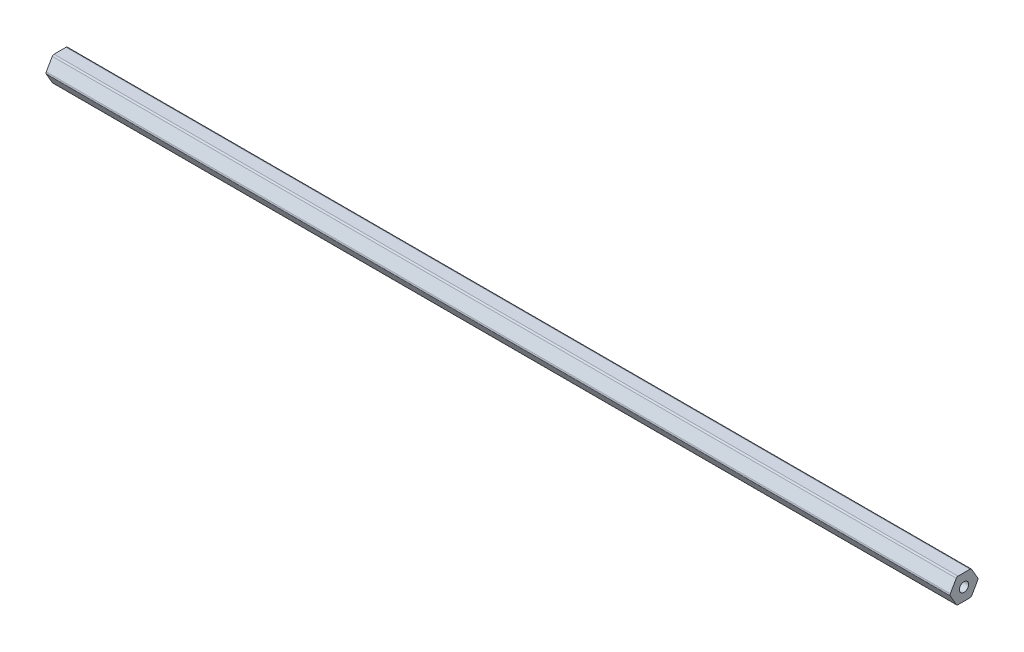
from build123d import *

# Parameters (mm, degrees)
BOSS_EXTRUDE1_DEPTH      = 231.775
BOSS_EXTRUDE1_DEPTH_BACK = 231.775
SKETCH1_R                = 2.38125


with BuildPart() as part:
    # Sketch1 → Boss-Extrude1 (new, two sides: drawn at the far end of the back side and taken through both)
    with BuildSketch(Plane(origin=(0, 0, 0), x_dir=(0, 0, -1), z_dir=(1, 0, 0)).offset(-BOSS_EXTRUDE1_DEPTH_BACK)):
        with BuildLine():
            Line((7.039054482, 0.508), (3.959468146, 5.842))
            ThreePointArc((3.959468146, 5.842), (3.587586336, 6.21388181), (3.079586336, 6.35))
            Line((3.079586336, 6.35), (-3.079586336, 6.35))
            ThreePointArc((-3.079586336, 6.35), (-3.587586336, 6.21388181), (-3.959468146, 5.842))
            Line((-3.959468146, 5.842), (-7.039054482, 0.508))
            ThreePointArc((-7.039054482, 0.508), (-7.175172672, 0), (-7.039054482, -0.508))
            Line((-7.039054482, -0.508), (-3.959468146, -5.842))
            ThreePointArc((-3.959468146, -5.842), (-3.587586336, -6.21388181), (-3.079586336, -6.35))
            Line((-3.079586336, -6.35), (3.079586336, -6.35))
            ThreePointArc((3.079586336, -6.35), (3.587586336, -6.21388181), (3.959468146, -5.842))
            Line((3.959468146, -5.842), (7.039054482, -0.508))
            ThreePointArc((7.039054482, -0.508), (7.175172672, 0), (7.039054482, 0.508))
        make_face()
        Circle(SKETCH1_R, mode=Mode.SUBTRACT)
    extrude(amount=BOSS_EXTRUDE1_DEPTH + BOSS_EXTRUDE1_DEPTH_BACK)


solid = part.part
